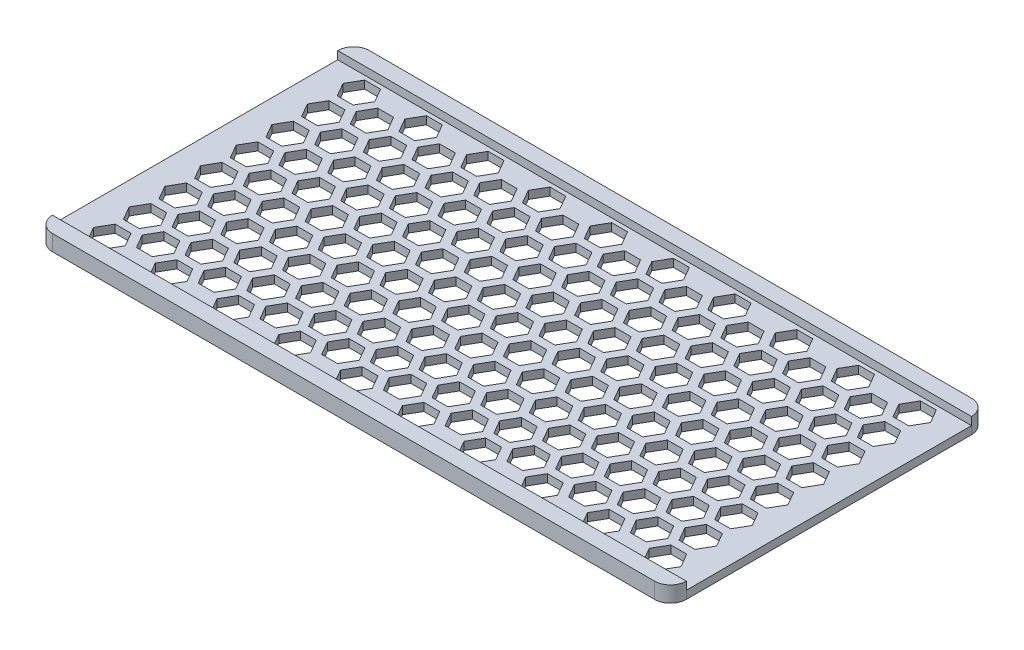
from build123d import *

# Parameters (mm, degrees)
CROQUIS1_W              = 80
CROQUIS1_H              = 2
CROQUIS1_H_2            = 14.5
CROQUIS1_H_3            = 7
SALIENTE_EXTRUIR1_DEPTH = 1
CROQUIS2_W              = 80
CROQUIS2_H              = 2
SALIENTE_EXTRUIR3_DEPTH = 1
REDONDEO1_R             = 2
PATR_N_DE_RAYADO1_DEPTH = 1


# Read off the part's stored shape, not the designer's step: Patrón de rayado1
with BuildPart() as part:
    # Croquis1 → Saliente-Extruir1 (new body)
    with BuildSketch(Plane(origin=(0, 0, 0), x_dir=(1, 0, 0), z_dir=(0, 1, 0))):
        with Locations((0, -19)):
            Rectangle(CROQUIS1_W, CROQUIS1_H)
        with Locations((0, -10.75)):
            Rectangle(CROQUIS1_W, CROQUIS1_H_2)
        Rectangle(CROQUIS1_W, CROQUIS1_H_3)
        with Locations((0, 10.75)):
            Rectangle(CROQUIS1_W, CROQUIS1_H_2)
        with Locations((0, 19)):
            Rectangle(CROQUIS1_W, CROQUIS1_H)
    extrude(amount=SALIENTE_EXTRUIR1_DEPTH)

    # Croquis2 → Saliente-Extruir3 (add)
    with BuildSketch(Plane(origin=(0, 1, 0), x_dir=(1, 0, 0), z_dir=(0, 1, 0))):
        with Locations((0, 19)):
            Rectangle(CROQUIS2_W, CROQUIS2_H)
        with Locations((0, -19)):
            Rectangle(CROQUIS2_W, CROQUIS2_H)
    extrude(amount=SALIENTE_EXTRUIR3_DEPTH)

    # Redondeo1
    redondeo1_edges = [part.edges().sort_by_distance(p)[0] for p in [
        (-40, 1, -20),
        (40, 1, -20),
        (40, 1, 20),
        (-40, 1, 20),
    ]]
    fillet(redondeo1_edges, radius=REDONDEO1_R - 0.0001)  # a hair under: the kernel refuses the full size

    # Patrón de rayado1 outline → Patrón de rayado1 (cut)
    with BuildSketch(Plane(origin=(0, 0, 0), x_dir=(1, 0, 0), z_dir=(0, 1, 0))):
        Polygon((37.074028853, -15.75), (36.074028853, -14.017949192), (34.074028853, -14.017949192), (33.074028853, -15.75), (34.074028853, -17.482050808), (36.074028853, -17.482050808), align=None)
        Polygon((21.485571585, 11.25), (20.485571585, 12.982050808), (18.485571585, 12.982050808), (17.485571585, 11.25), (18.485571585, 9.517949192), (20.485571585, 9.517949192), align=None)
        Polygon((33.176914536, -9), (32.176914536, -7.267949192), (30.176914536, -7.267949192), (29.176914536, -9), (30.176914536, -10.732050808), (32.176914536, -10.732050808), align=None)
        Polygon((25.382685902, 4.5), (24.382685902, 6.232050808), (22.382685902, 6.232050808), (21.382685902, 4.5), (22.382685902, 2.767949192), (24.382685902, 2.767949192), align=None)
        Polygon((29.279800219, -2.25), (28.279800219, -0.517949192), (26.279800219, -0.517949192), (25.279800219, -2.25), (26.279800219, -3.982050808), (28.279800219, -3.982050808), align=None)
        Polygon((28.279800219, -14.017949192), (26.279800219, -14.017949192), (25.279800219, -15.75), (26.279800219, -17.482050808), (28.279800219, -17.482050808), (29.279800219, -15.75), align=None)
        Polygon((20.485571585, -14.017949192), (18.485571585, -14.017949192), (17.485571585, -15.75), (18.485571585, -17.482050808), (20.485571585, -17.482050808), (21.485571585, -15.75), align=None)
        Polygon((12.691342951, -14.017949192), (10.691342951, -14.017949192), (9.691342951, -15.75), (10.691342951, -17.482050808), (12.691342951, -17.482050808), (13.691342951, -15.75), align=None)
        Polygon((4.897114317, -14.017949192), (2.897114317, -14.017949192), (1.897114317, -15.75), (2.897114317, -17.482050808), (4.897114317, -17.482050808), (5.897114317, -15.75), align=None)
        Polygon((-2.897114317, -14.017949192), (-4.897114317, -14.017949192), (-5.897114317, -15.75), (-4.897114317, -17.482050808), (-2.897114317, -17.482050808), (-1.897114317, -15.75), align=None)
        Polygon((-10.691342951, -14.017949192), (-12.691342951, -14.017949192), (-13.691342951, -15.75), (-12.691342951, -17.482050808), (-10.691342951, -17.482050808), (-9.691342951, -15.75), align=None)
        Polygon((-18.485571585, -14.017949192), (-20.485571585, -14.017949192), (-21.485571585, -15.75), (-20.485571585, -17.482050808), (-18.485571585, -17.482050808), (-17.485571585, -15.75), align=None)
        Polygon((-26.279800219, -14.017949192), (-28.279800219, -14.017949192), (-29.279800219, -15.75), (-28.279800219, -17.482050808), (-26.279800219, -17.482050808), (-25.279800219, -15.75), align=None)
        Polygon((-34.074028853, -14.017949192), (-36.074028853, -14.017949192), (-37.074028853, -15.75), (-36.074028853, -17.482050808), (-34.074028853, -17.482050808), (-33.074028853, -15.75), align=None)
        Polygon((13.691342951, 15.75), (12.691342951, 17.482050808), (10.691342951, 17.482050808), (9.691342951, 15.75), (10.691342951, 14.017949192), (12.691342951, 14.017949192), align=None)
        Polygon((17.588457268, 9), (16.588457268, 10.732050808), (14.588457268, 10.732050808), (13.588457268, 9), (14.588457268, 7.267949192), (16.588457268, 7.267949192), align=None)
        Polygon((29.279800219, -11.25), (28.279800219, -9.517949192), (26.279800219, -9.517949192), (25.279800219, -11.25), (26.279800219, -12.982050808), (28.279800219, -12.982050808), align=None)
        Polygon((21.485571585, 2.25), (20.485571585, 3.982050808), (18.485571585, 3.982050808), (17.485571585, 2.25), (18.485571585, 0.517949192), (20.485571585, 0.517949192), align=None)
        Polygon((25.382685902, -4.5), (24.382685902, -2.767949192), (22.382685902, -2.767949192), (21.382685902, -4.5), (22.382685902, -6.232050808), (24.382685902, -6.232050808), align=None)
        Polygon((20.485571585, 17.482050808), (18.485571585, 17.482050808), (17.485571585, 15.75), (18.485571585, 14.017949192), (20.485571585, 14.017949192), (21.485571585, 15.75), align=None)
        Polygon((28.279800219, 17.482050808), (26.279800219, 17.482050808), (25.279800219, 15.75), (26.279800219, 14.017949192), (28.279800219, 14.017949192), (29.279800219, 15.75), align=None)
        Polygon((36.074028853, 17.482050808), (34.074028853, 17.482050808), (33.074028853, 15.75), (34.074028853, 14.017949192), (36.074028853, 14.017949192), (37.074028853, 15.75), align=None)
        Polygon((-26.279800219, 17.482050808), (-28.279800219, 17.482050808), (-29.279800219, 15.75), (-28.279800219, 14.017949192), (-26.279800219, 14.017949192), (-25.279800219, 15.75), align=None)
        Polygon((-34.074028853, 17.482050808), (-36.074028853, 17.482050808), (-37.074028853, 15.75), (-36.074028853, 14.017949192), (-34.074028853, 14.017949192), (-33.074028853, 15.75), align=None)
        Polygon((-2.897114317, 17.482050808), (-4.897114317, 17.482050808), (-5.897114317, 15.75), (-4.897114317, 14.017949192), (-2.897114317, 14.017949192), (-1.897114317, 15.75), align=None)
        Polygon((4.897114317, 17.482050808), (2.897114317, 17.482050808), (1.897114317, 15.75), (2.897114317, 14.017949192), (4.897114317, 14.017949192), (5.897114317, 15.75), align=None)
        Polygon((-18.485571585, 17.482050808), (-20.485571585, 17.482050808), (-21.485571585, 15.75), (-20.485571585, 14.017949192), (-18.485571585, 14.017949192), (-17.485571585, 15.75), align=None)
        Polygon((-10.691342951, 17.482050808), (-12.691342951, 17.482050808), (-13.691342951, 15.75), (-12.691342951, 14.017949192), (-10.691342951, 14.017949192), (-9.691342951, 15.75), align=None)
        Polygon((6.794228634, 10.732050808), (5.794228634, 9), (6.794228634, 7.267949192), (8.794228634, 7.267949192), (9.794228634, 9), (8.794228634, 10.732050808), align=None)
        Polygon((-4.897114317, -9.517949192), (-5.897114317, -11.25), (-4.897114317, -12.982050808), (-2.897114317, -12.982050808), (-1.897114317, -11.25), (-2.897114317, -9.517949192), align=None)
        Polygon((2.897114317, 3.982050808), (1.897114317, 2.25), (2.897114317, 0.517949192), (4.897114317, 0.517949192), (5.897114317, 2.25), (4.897114317, 3.982050808), align=None)
        Polygon((-1, -2.767949192), (-2, -4.5), (-1, -6.232050808), (1, -6.232050808), (2, -4.5), (1, -2.767949192), align=None)
        Polygon((13.691342951, 11.25), (12.691342951, 12.982050808), (10.691342951, 12.982050808), (9.691342951, 11.25), (10.691342951, 9.517949192), (12.691342951, 9.517949192), align=None)
        Polygon((25.382685902, -9), (24.382685902, -7.267949192), (22.382685902, -7.267949192), (21.382685902, -9), (22.382685902, -10.732050808), (24.382685902, -10.732050808), align=None)
        Polygon((17.588457268, 4.5), (16.588457268, 6.232050808), (14.588457268, 6.232050808), (13.588457268, 4.5), (14.588457268, 2.767949192), (16.588457268, 2.767949192), align=None)
        Polygon((21.485571585, -2.25), (20.485571585, -0.517949192), (18.485571585, -0.517949192), (17.485571585, -2.25), (18.485571585, -3.982050808), (20.485571585, -3.982050808), align=None)
        Polygon((28.279800219, 12.982050808), (26.279800219, 12.982050808), (25.279800219, 11.25), (26.279800219, 9.517949192), (28.279800219, 9.517949192), (29.279800219, 11.25), align=None)
        Polygon((36.074028853, 12.982050808), (34.074028853, 12.982050808), (33.074028853, 11.25), (34.074028853, 9.517949192), (36.074028853, 9.517949192), (37.074028853, 11.25), align=None)
        Polygon((-26.279800219, 12.982050808), (-28.279800219, 12.982050808), (-29.279800219, 11.25), (-28.279800219, 9.517949192), (-26.279800219, 9.517949192), (-25.279800219, 11.25), align=None)
        Polygon((-34.074028853, 12.982050808), (-36.074028853, 12.982050808), (-37.074028853, 11.25), (-36.074028853, 9.517949192), (-34.074028853, 9.517949192), (-33.074028853, 11.25), align=None)
        Polygon((-2.897114317, 12.982050808), (-4.897114317, 12.982050808), (-5.897114317, 11.25), (-4.897114317, 9.517949192), (-2.897114317, 9.517949192), (-1.897114317, 11.25), align=None)
        Polygon((4.897114317, 12.982050808), (2.897114317, 12.982050808), (1.897114317, 11.25), (2.897114317, 9.517949192), (4.897114317, 9.517949192), (5.897114317, 11.25), align=None)
        Polygon((-18.485571585, 12.982050808), (-20.485571585, 12.982050808), (-21.485571585, 11.25), (-20.485571585, 9.517949192), (-18.485571585, 9.517949192), (-17.485571585, 11.25), align=None)
        Polygon((-10.691342951, 12.982050808), (-12.691342951, 12.982050808), (-13.691342951, 11.25), (-12.691342951, 9.517949192), (-10.691342951, 9.517949192), (-9.691342951, 11.25), align=None)
        Polygon((-1, -7.267949192), (-2, -9), (-1, -10.732050808), (1, -10.732050808), (2, -9), (1, -7.267949192), align=None)
        Polygon((6.794228634, 6.232050808), (5.794228634, 4.5), (6.794228634, 2.767949192), (8.794228634, 2.767949192), (9.794228634, 4.5), (8.794228634, 6.232050808), align=None)
        Polygon((2.897114317, -0.517949192), (1.897114317, -2.25), (2.897114317, -3.982050808), (4.897114317, -3.982050808), (5.897114317, -2.25), (4.897114317, -0.517949192), align=None)
        Polygon((6.794228634, -7.267949192), (5.794228634, -9), (6.794228634, -10.732050808), (8.794228634, -10.732050808), (9.794228634, -9), (8.794228634, -7.267949192), align=None)
        Polygon((10.691342951, -0.517949192), (9.691342951, -2.25), (10.691342951, -3.982050808), (12.691342951, -3.982050808), (13.691342951, -2.25), (12.691342951, -0.517949192), align=None)
        Polygon((33.176914536, 4.5), (32.176914536, 6.232050808), (30.176914536, 6.232050808), (29.176914536, 4.5), (30.176914536, 2.767949192), (32.176914536, 2.767949192), align=None)
        Polygon((37.074028853, -2.25), (36.074028853, -0.517949192), (34.074028853, -0.517949192), (33.074028853, -2.25), (34.074028853, -3.982050808), (36.074028853, -3.982050808), align=None)
        Polygon((14.588457268, -7.267949192), (13.588457268, -9), (14.588457268, -10.732050808), (16.588457268, -10.732050808), (17.588457268, -9), (16.588457268, -7.267949192), align=None)
        Polygon((-22.382685902, 10.732050808), (-24.382685902, 10.732050808), (-25.382685902, 9), (-24.382685902, 7.267949192), (-22.382685902, 7.267949192), (-21.382685902, 9), align=None)
        Polygon((-30.176914536, 10.732050808), (-32.176914536, 10.732050808), (-33.176914536, 9), (-32.176914536, 7.267949192), (-30.176914536, 7.267949192), (-29.176914536, 9), align=None)
        Polygon((-6.794228634, 10.732050808), (-8.794228634, 10.732050808), (-9.794228634, 9), (-8.794228634, 7.267949192), (-6.794228634, 7.267949192), (-5.794228634, 9), align=None)
        Polygon((32.176914536, 10.732050808), (30.176914536, 10.732050808), (29.176914536, 9), (30.176914536, 7.267949192), (32.176914536, 7.267949192), (33.176914536, 9), align=None)
        Polygon((24.382685902, 10.732050808), (22.382685902, 10.732050808), (21.382685902, 9), (22.382685902, 7.267949192), (24.382685902, 7.267949192), (25.382685902, 9), align=None)
        Polygon((1, 10.732050808), (-1, 10.732050808), (-2, 9), (-1, 7.267949192), (1, 7.267949192), (2, 9), align=None)
        Polygon((-14.588457268, 10.732050808), (-16.588457268, 10.732050808), (-17.588457268, 9), (-16.588457268, 7.267949192), (-14.588457268, 7.267949192), (-13.588457268, 9), align=None)
        Polygon((2.897114317, -9.517949192), (1.897114317, -11.25), (2.897114317, -12.982050808), (4.897114317, -12.982050808), (5.897114317, -11.25), (4.897114317, -9.517949192), align=None)
        Polygon((10.691342951, 3.982050808), (9.691342951, 2.25), (10.691342951, 0.517949192), (12.691342951, 0.517949192), (13.691342951, 2.25), (12.691342951, 3.982050808), align=None)
        Polygon((6.794228634, -2.767949192), (5.794228634, -4.5), (6.794228634, -6.232050808), (8.794228634, -6.232050808), (9.794228634, -4.5), (8.794228634, -2.767949192), align=None)
        Polygon((21.485571585, -11.25), (20.485571585, -9.517949192), (18.485571585, -9.517949192), (17.485571585, -11.25), (18.485571585, -12.982050808), (20.485571585, -12.982050808), align=None)
        Polygon((17.588457268, -4.5), (16.588457268, -2.767949192), (14.588457268, -2.767949192), (13.588457268, -4.5), (14.588457268, -6.232050808), (16.588457268, -6.232050808), align=None)
        Polygon((9.794228634, 13.5), (8.794228634, 15.232050808), (6.794228634, 15.232050808), (5.794228634, 13.5), (6.794228634, 11.767949192), (8.794228634, 11.767949192), align=None)
        Polygon((21.485571585, -6.75), (20.485571585, -5.017949192), (18.485571585, -5.017949192), (17.485571585, -6.75), (18.485571585, -8.482050808), (20.485571585, -8.482050808), align=None)
        Polygon((25.382685902, -13.5), (24.382685902, -11.767949192), (22.382685902, -11.767949192), (21.382685902, -13.5), (22.382685902, -15.232050808), (24.382685902, -15.232050808), align=None)
        Polygon((17.588457268, 0), (16.588457268, 1.732050808), (14.588457268, 1.732050808), (13.588457268, 0), (14.588457268, -1.732050808), (16.588457268, -1.732050808), align=None)
        Polygon((13.691342951, 6.75), (12.691342951, 8.482050808), (10.691342951, 8.482050808), (9.691342951, 6.75), (10.691342951, 5.017949192), (12.691342951, 5.017949192), align=None)
        Polygon((32.176914536, 15.232050808), (30.176914536, 15.232050808), (29.176914536, 13.5), (30.176914536, 11.767949192), (32.176914536, 11.767949192), (33.176914536, 13.5), align=None)
        Polygon((24.382685902, 15.232050808), (22.382685902, 15.232050808), (21.382685902, 13.5), (22.382685902, 11.767949192), (24.382685902, 11.767949192), (25.382685902, 13.5), align=None)
        Polygon((16.588457268, 15.232050808), (14.588457268, 15.232050808), (13.588457268, 13.5), (14.588457268, 11.767949192), (16.588457268, 11.767949192), (17.588457268, 13.5), align=None)
        Polygon((-22.382685902, 15.232050808), (-24.382685902, 15.232050808), (-25.382685902, 13.5), (-24.382685902, 11.767949192), (-22.382685902, 11.767949192), (-21.382685902, 13.5), align=None)
        Polygon((-30.176914536, 15.232050808), (-32.176914536, 15.232050808), (-33.176914536, 13.5), (-32.176914536, 11.767949192), (-30.176914536, 11.767949192), (-29.176914536, 13.5), align=None)
        Polygon((-6.794228634, 15.232050808), (-8.794228634, 15.232050808), (-9.794228634, 13.5), (-8.794228634, 11.767949192), (-6.794228634, 11.767949192), (-5.794228634, 13.5), align=None)
        Polygon((1, 15.232050808), (-1, 15.232050808), (-2, 13.5), (-1, 11.767949192), (1, 11.767949192), (2, 13.5), align=None)
        Polygon((-14.588457268, 15.232050808), (-16.588457268, 15.232050808), (-17.588457268, 13.5), (-16.588457268, 11.767949192), (-14.588457268, 11.767949192), (-13.588457268, 13.5), align=None)
        Polygon((-8.794228634, -11.767949192), (-9.794228634, -13.5), (-8.794228634, -15.232050808), (-6.794228634, -15.232050808), (-5.794228634, -13.5), (-6.794228634, -11.767949192), align=None)
        Polygon((-1, 1.732050808), (-2, 0), (-1, -1.732050808), (1, -1.732050808), (2, 0), (1, 1.732050808), align=None)
        Polygon((2.897114317, 8.482050808), (1.897114317, 6.75), (2.897114317, 5.017949192), (4.897114317, 5.017949192), (5.897114317, 6.75), (4.897114317, 8.482050808), align=None)
        Polygon((-4.897114317, -5.017949192), (-5.897114317, -6.75), (-4.897114317, -8.482050808), (-2.897114317, -8.482050808), (-1.897114317, -6.75), (-2.897114317, -5.017949192), align=None)
        Polygon((37.074028853, -11.25), (36.074028853, -9.517949192), (34.074028853, -9.517949192), (33.074028853, -11.25), (34.074028853, -12.982050808), (36.074028853, -12.982050808), align=None)
        Polygon((29.279800219, 2.25), (28.279800219, 3.982050808), (26.279800219, 3.982050808), (25.279800219, 2.25), (26.279800219, 0.517949192), (28.279800219, 0.517949192), align=None)
        Polygon((33.176914536, -4.5), (32.176914536, -2.767949192), (30.176914536, -2.767949192), (29.176914536, -4.5), (30.176914536, -6.232050808), (32.176914536, -6.232050808), align=None)
        Polygon((37.074028853, 2.25), (36.074028853, 3.982050808), (34.074028853, 3.982050808), (33.074028853, 2.25), (34.074028853, 0.517949192), (36.074028853, 0.517949192), align=None)
        Polygon((10.691342951, -9.517949192), (9.691342951, -11.25), (10.691342951, -12.982050808), (12.691342951, -12.982050808), (13.691342951, -11.25), (12.691342951, -9.517949192), align=None)
        Polygon((37.074028853, 6.75), (36.074028853, 8.482050808), (34.074028853, 8.482050808), (33.074028853, 6.75), (34.074028853, 5.017949192), (36.074028853, 5.017949192), align=None)
        Polygon((14.588457268, -11.767949192), (13.588457268, -13.5), (14.588457268, -15.232050808), (16.588457268, -15.232050808), (17.588457268, -13.5), (16.588457268, -11.767949192), align=None)
        Polygon((26.279800219, 8.482050808), (25.279800219, 6.75), (26.279800219, 5.017949192), (28.279800219, 5.017949192), (29.279800219, 6.75), (28.279800219, 8.482050808), align=None)
        Polygon((22.382685902, 1.732050808), (21.382685902, 0), (22.382685902, -1.732050808), (24.382685902, -1.732050808), (25.382685902, 0), (24.382685902, 1.732050808), align=None)
        Polygon((37.074028853, -6.75), (36.074028853, -5.017949192), (34.074028853, -5.017949192), (33.074028853, -6.75), (34.074028853, -8.482050808), (36.074028853, -8.482050808), align=None)
        Polygon((33.176914536, 0), (32.176914536, 1.732050808), (30.176914536, 1.732050808), (29.176914536, 0), (30.176914536, -1.732050808), (32.176914536, -1.732050808), align=None)
        Polygon((10.691342951, -5.017949192), (9.691342951, -6.75), (10.691342951, -8.482050808), (12.691342951, -8.482050808), (13.691342951, -6.75), (12.691342951, -5.017949192), align=None)
        Polygon((6.794228634, -11.767949192), (5.794228634, -13.5), (6.794228634, -15.232050808), (8.794228634, -15.232050808), (9.794228634, -13.5), (8.794228634, -11.767949192), align=None)
        Polygon((18.485571585, 8.482050808), (17.485571585, 6.75), (18.485571585, 5.017949192), (20.485571585, 5.017949192), (21.485571585, 6.75), (20.485571585, 8.482050808), align=None)
        Polygon((29.279800219, -6.75), (28.279800219, -5.017949192), (26.279800219, -5.017949192), (25.279800219, -6.75), (26.279800219, -8.482050808), (28.279800219, -8.482050808), align=None)
        Polygon((33.176914536, -13.5), (32.176914536, -11.767949192), (30.176914536, -11.767949192), (29.176914536, -13.5), (30.176914536, -15.232050808), (32.176914536, -15.232050808), align=None)
        Polygon((2.897114317, -5.017949192), (1.897114317, -6.75), (2.897114317, -8.482050808), (4.897114317, -8.482050808), (5.897114317, -6.75), (4.897114317, -5.017949192), align=None)
        Polygon((-1, -11.767949192), (-2, -13.5), (-1, -15.232050808), (1, -15.232050808), (2, -13.5), (1, -11.767949192), align=None)
        Polygon((6.794228634, 1.732050808), (5.794228634, 0), (6.794228634, -1.732050808), (8.794228634, -1.732050808), (9.794228634, 0), (8.794228634, 1.732050808), align=None)
        Polygon((-25.279800219, -6.75), (-26.279800219, -5.017949192), (-28.279800219, -5.017949192), (-29.279800219, -6.75), (-28.279800219, -8.482050808), (-26.279800219, -8.482050808), align=None)
        Polygon((-33.074028853, 6.75), (-34.074028853, 8.482050808), (-36.074028853, 8.482050808), (-37.074028853, 6.75), (-36.074028853, 5.017949192), (-34.074028853, 5.017949192), align=None)
        Polygon((-29.176914536, 0), (-30.176914536, 1.732050808), (-32.176914536, 1.732050808), (-33.176914536, 0), (-32.176914536, -1.732050808), (-30.176914536, -1.732050808), align=None)
        Polygon((-21.382685902, -13.5), (-22.382685902, -11.767949192), (-24.382685902, -11.767949192), (-25.382685902, -13.5), (-24.382685902, -15.232050808), (-22.382685902, -15.232050808), align=None)
        Polygon((-34.074028853, -5.017949192), (-36.074028853, -5.017949192), (-37.074028853, -6.75), (-36.074028853, -8.482050808), (-34.074028853, -8.482050808), (-33.074028853, -6.75), align=None)
        Polygon((-18.485571585, -5.017949192), (-20.485571585, -5.017949192), (-21.485571585, -6.75), (-20.485571585, -8.482050808), (-18.485571585, -8.482050808), (-17.485571585, -6.75), align=None)
        Polygon((-10.691342951, -5.017949192), (-12.691342951, -5.017949192), (-13.691342951, -6.75), (-12.691342951, -8.482050808), (-10.691342951, -8.482050808), (-9.691342951, -6.75), align=None)
        Polygon((-24.382685902, 1.732050808), (-25.382685902, 0), (-24.382685902, -1.732050808), (-22.382685902, -1.732050808), (-21.382685902, 0), (-22.382685902, 1.732050808), align=None)
        Polygon((-32.176914536, -11.767949192), (-33.176914536, -13.5), (-32.176914536, -15.232050808), (-30.176914536, -15.232050808), (-29.176914536, -13.5), (-30.176914536, -11.767949192), align=None)
        Polygon((-20.485571585, 8.482050808), (-21.485571585, 6.75), (-20.485571585, 5.017949192), (-18.485571585, 5.017949192), (-17.485571585, 6.75), (-18.485571585, 8.482050808), align=None)
        Polygon((-25.279800219, -2.25), (-26.279800219, -0.517949192), (-28.279800219, -0.517949192), (-29.279800219, -2.25), (-28.279800219, -3.982050808), (-26.279800219, -3.982050808), align=None)
        Polygon((-21.382685902, -9), (-22.382685902, -7.267949192), (-24.382685902, -7.267949192), (-25.382685902, -9), (-24.382685902, -10.732050808), (-22.382685902, -10.732050808), align=None)
        Polygon((-29.176914536, 4.5), (-30.176914536, 6.232050808), (-32.176914536, 6.232050808), (-33.176914536, 4.5), (-32.176914536, 2.767949192), (-30.176914536, 2.767949192), align=None)
        Polygon((-34.074028853, -0.517949192), (-36.074028853, -0.517949192), (-37.074028853, -2.25), (-36.074028853, -3.982050808), (-34.074028853, -3.982050808), (-33.074028853, -2.25), align=None)
        Polygon((-18.485571585, -0.517949192), (-20.485571585, -0.517949192), (-21.485571585, -2.25), (-20.485571585, -3.982050808), (-18.485571585, -3.982050808), (-17.485571585, -2.25), align=None)
        Polygon((-2.897114317, -0.517949192), (-4.897114317, -0.517949192), (-5.897114317, -2.25), (-4.897114317, -3.982050808), (-2.897114317, -3.982050808), (-1.897114317, -2.25), align=None)
        Polygon((-10.691342951, -0.517949192), (-12.691342951, -0.517949192), (-13.691342951, -2.25), (-12.691342951, -3.982050808), (-10.691342951, -3.982050808), (-9.691342951, -2.25), align=None)
        Polygon((-24.382685902, 6.232050808), (-25.382685902, 4.5), (-24.382685902, 2.767949192), (-22.382685902, 2.767949192), (-21.382685902, 4.5), (-22.382685902, 6.232050808), align=None)
        Polygon((-32.176914536, -7.267949192), (-33.176914536, -9), (-32.176914536, -10.732050808), (-30.176914536, -10.732050808), (-29.176914536, -9), (-30.176914536, -7.267949192), align=None)
        Polygon((-25.279800219, 2.25), (-26.279800219, 3.982050808), (-28.279800219, 3.982050808), (-29.279800219, 2.25), (-28.279800219, 0.517949192), (-26.279800219, 0.517949192), align=None)
        Polygon((-17.485571585, -11.25), (-18.485571585, -9.517949192), (-20.485571585, -9.517949192), (-21.485571585, -11.25), (-20.485571585, -12.982050808), (-18.485571585, -12.982050808), align=None)
        Polygon((-21.382685902, -4.5), (-22.382685902, -2.767949192), (-24.382685902, -2.767949192), (-25.382685902, -4.5), (-24.382685902, -6.232050808), (-22.382685902, -6.232050808), align=None)
        Polygon((-34.074028853, 3.982050808), (-36.074028853, 3.982050808), (-37.074028853, 2.25), (-36.074028853, 0.517949192), (-34.074028853, 0.517949192), (-33.074028853, 2.25), align=None)
        Polygon((-2.897114317, 3.982050808), (-4.897114317, 3.982050808), (-5.897114317, 2.25), (-4.897114317, 0.517949192), (-2.897114317, 0.517949192), (-1.897114317, 2.25), align=None)
        Polygon((-18.485571585, 3.982050808), (-20.485571585, 3.982050808), (-21.485571585, 2.25), (-20.485571585, 0.517949192), (-18.485571585, 0.517949192), (-17.485571585, 2.25), align=None)
        Polygon((-10.691342951, 3.982050808), (-12.691342951, 3.982050808), (-13.691342951, 2.25), (-12.691342951, 0.517949192), (-10.691342951, 0.517949192), (-9.691342951, 2.25), align=None)
        Polygon((-36.074028853, -9.517949192), (-37.074028853, -11.25), (-36.074028853, -12.982050808), (-34.074028853, -12.982050808), (-33.074028853, -11.25), (-34.074028853, -9.517949192), align=None)
        Polygon((-32.176914536, -2.767949192), (-33.176914536, -4.5), (-32.176914536, -6.232050808), (-30.176914536, -6.232050808), (-29.176914536, -4.5), (-30.176914536, -2.767949192), align=None)
        Polygon((-25.279800219, 6.75), (-26.279800219, 8.482050808), (-28.279800219, 8.482050808), (-29.279800219, 6.75), (-28.279800219, 5.017949192), (-26.279800219, 5.017949192), align=None)
        Polygon((-13.588457268, -13.5), (-14.588457268, -11.767949192), (-16.588457268, -11.767949192), (-17.588457268, -13.5), (-16.588457268, -15.232050808), (-14.588457268, -15.232050808), align=None)
        Polygon((-2.897114317, 8.482050808), (-4.897114317, 8.482050808), (-5.897114317, 6.75), (-4.897114317, 5.017949192), (-2.897114317, 5.017949192), (-1.897114317, 6.75), align=None)
        Polygon((-10.691342951, 8.482050808), (-12.691342951, 8.482050808), (-13.691342951, 6.75), (-12.691342951, 5.017949192), (-10.691342951, 5.017949192), (-9.691342951, 6.75), align=None)
        Polygon((-13.588457268, -9), (-14.588457268, -7.267949192), (-16.588457268, -7.267949192), (-17.588457268, -9), (-16.588457268, -10.732050808), (-14.588457268, -10.732050808), align=None)
        Polygon((-9.691342951, -11.25), (-10.691342951, -9.517949192), (-12.691342951, -9.517949192), (-13.691342951, -11.25), (-12.691342951, -12.982050808), (-10.691342951, -12.982050808), align=None)
        Polygon((-13.588457268, -4.5), (-14.588457268, -2.767949192), (-16.588457268, -2.767949192), (-17.588457268, -4.5), (-16.588457268, -6.232050808), (-14.588457268, -6.232050808), align=None)
        Polygon((-6.794228634, -7.267949192), (-8.794228634, -7.267949192), (-9.794228634, -9), (-8.794228634, -10.732050808), (-6.794228634, -10.732050808), (-5.794228634, -9), align=None)
        Polygon((-25.279800219, -11.25), (-26.279800219, -9.517949192), (-28.279800219, -9.517949192), (-29.279800219, -11.25), (-28.279800219, -12.982050808), (-26.279800219, -12.982050808), align=None)
        Polygon((-8.794228634, -2.767949192), (-9.794228634, -4.5), (-8.794228634, -6.232050808), (-6.794228634, -6.232050808), (-5.794228634, -4.5), (-6.794228634, -2.767949192), align=None)
        Polygon((-13.588457268, 0), (-14.588457268, 1.732050808), (-16.588457268, 1.732050808), (-17.588457268, 0), (-16.588457268, -1.732050808), (-14.588457268, -1.732050808), align=None)
        Polygon((-6.794228634, 6.232050808), (-8.794228634, 6.232050808), (-9.794228634, 4.5), (-8.794228634, 2.767949192), (-6.794228634, 2.767949192), (-5.794228634, 4.5), align=None)
        Polygon((1, 6.232050808), (-1, 6.232050808), (-2, 4.5), (-1, 2.767949192), (1, 2.767949192), (2, 4.5), align=None)
        Polygon((-14.588457268, 6.232050808), (-16.588457268, 6.232050808), (-17.588457268, 4.5), (-16.588457268, 2.767949192), (-14.588457268, 2.767949192), (-13.588457268, 4.5), align=None)
        Polygon((-6.794228634, 1.732050808), (-8.794228634, 1.732050808), (-9.794228634, 0), (-8.794228634, -1.732050808), (-6.794228634, -1.732050808), (-5.794228634, 0), align=None)
    extrude(amount=PATR_N_DE_RAYADO1_DEPTH, mode=Mode.SUBTRACT)


solid = part.part
